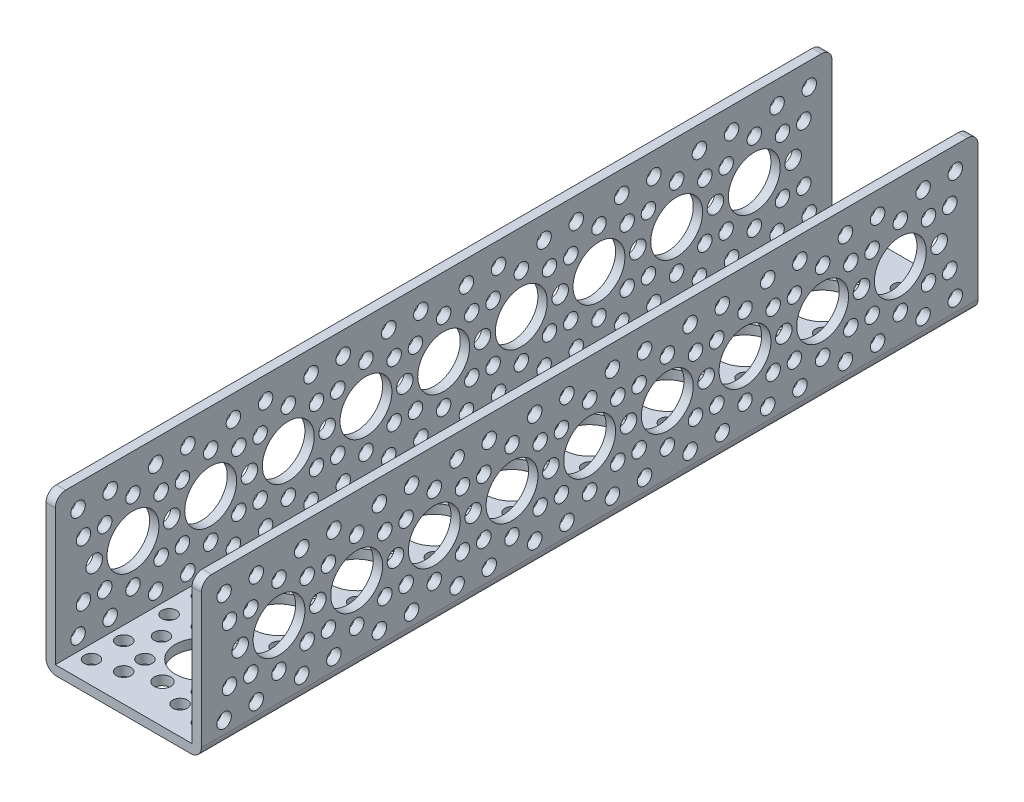
from build123d import *

# Parameters (mm, degrees)
SKETCH1_W                 = 38.1
SKETCH1_H                 = 190.5
BOSS_EXTRUDE1_DEPTH       = 38.1
SKETCH2_W                 = 33.528
SKETCH2_H                 = 35.814
CUT_EXTRUDE1_DEPTH        = 198.973407305
HOLE1_D                   = 12.7254
HOLE1_DEPTH               = 2.286
F_5_CLEARANCE_HOLE1_D     = 3.556
F_5_CLEARANCE_HOLE1_DEPTH = 2.286
F_6_CLEARANCE_HOLE1_D     = 4.064
F_6_CLEARANCE_HOLE1_DEPTH = 2.286
HOLE2_D                   = 12.7254
HOLE2_DEPTH               = 38.1
F_6_CLEARANCE_HOLE2_D     = 4.064
F_6_CLEARANCE_HOLE2_DEPTH = 38.1
F_5_CLEARANCE_HOLE2_D     = 3.556
F_5_CLEARANCE_HOLE2_DEPTH = 38.1
HOLE3_D                   = 12.7254
HOLE3_DEPTH               = 38.1
F_5_CLEARANCE_HOLE3_D     = 3.556
F_5_CLEARANCE_HOLE3_DEPTH = 38.1
F_6_CLEARANCE_HOLE3_D     = 4.064
F_6_CLEARANCE_HOLE3_DEPTH = 38.1
FILLET1_R                 = 2.54


with BuildPart() as part:
    # Sketch1 → Boss-Extrude1 (new body)
    with BuildSketch(Plane.XZ):
        with Locations((19.05, 95.25)):
            Rectangle(SKETCH1_W, SKETCH1_H)
    extrude(amount=-BOSS_EXTRUDE1_DEPTH)

    # Sketch2 → Cut-Extrude1 (cut, through all)
    with BuildSketch(Plane.XY.offset(190.5)):
        with Locations((19.05, 20.193)):
            Rectangle(SKETCH2_W, SKETCH2_H)
    extrude(amount=-CUT_EXTRUDE1_DEPTH, mode=Mode.SUBTRACT)

    # Hole1
    with Locations(Plane(origin=(38.1, 0, 0), x_dir=(0, 0, -1), z_dir=(1, 0, 0))):
        with Locations((-38.1, 19.05), (-19.05, 19.05), (-57.15, 19.05), (-76.2, 19.05), (-95.25, 19.05), (-114.3, 19.05), (-133.35, 19.05), (-152.4, 19.05), (-171.45, 19.05)):
            Hole(HOLE1_D / 2, depth=HOLE1_DEPTH)

    # #5 Clearance Hole1
    with Locations(Plane(origin=(38.1, 0, 0), x_dir=(0, 0, -1), z_dir=(1, 0, 0))):
        with Locations((-177.029615818, 5.579615818), (-183.585202787, 12.135202787), (-177.029615818, 32.520384182), (-183.585202787, 25.964797213), (-13.470384182, 5.579615818), (-6.914797213, 12.135202787), (-13.470384182, 32.520384182), (-6.914797213, 25.964797213), (-157.979615818, 5.579615818), (-138.929615818, 5.579615818), (-119.879615818, 5.579615818), (-100.829615818, 5.579615818), (-81.779615818, 5.579615818), (-62.729615818, 5.579615818), (-43.679615818, 5.579615818), (-24.629615818, 5.579615818), (-157.979615818, 32.520384182), (-138.929615818, 32.520384182), (-119.879615818, 32.520384182), (-100.829615818, 32.520384182), (-81.779615818, 32.520384182), (-62.729615818, 32.520384182), (-43.679615818, 32.520384182), (-24.629615818, 32.520384182), (-184.920384182, 5.579615818), (-184.920384182, 32.520384182), (-165.870384182, 5.579615818), (-165.870384182, 32.520384182), (-146.820384182, 5.579615818), (-146.820384182, 32.520384182), (-127.770384182, 5.579615818), (-127.770384182, 32.520384182), (-108.720384182, 5.579615818), (-108.720384182, 32.520384182), (-89.670384182, 5.579615818), (-89.670384182, 32.520384182), (-70.620384182, 5.579615818), (-70.620384182, 32.520384182), (-51.570384182, 5.579615818), (-51.570384182, 32.520384182), (-38.1, 9.271), (-45.014797213, 12.135202787), (-45.014797213, 25.964797213), (-38.1, 28.829), (-31.185202787, 25.964797213), (-31.185202787, 12.135202787), (-32.520384182, 5.579615818), (-32.520384182, 32.520384182), (-5.579615818, 5.579615818), (-5.579615818, 32.520384182), (-12.135202787, 12.135202787), (-19.05, 9.271), (-25.964797213, 12.135202787), (-25.964797213, 25.964797213), (-19.05, 28.829), (-12.135202787, 25.964797213), (-50.235202787, 12.135202787), (-69.285202787, 12.135202787), (-88.335202787, 12.135202787), (-107.385202787, 12.135202787), (-126.435202787, 12.135202787), (-145.485202787, 12.135202787), (-164.535202787, 12.135202787), (-50.235202787, 25.964797213), (-69.285202787, 25.964797213), (-88.335202787, 25.964797213), (-107.385202787, 25.964797213), (-126.435202787, 25.964797213), (-145.485202787, 25.964797213), (-164.535202787, 25.964797213), (-57.15, 28.829), (-76.2, 28.829), (-95.25, 28.829), (-114.3, 28.829), (-133.35, 28.829), (-152.4, 28.829), (-171.45, 28.829), (-64.064797213, 25.964797213), (-83.114797213, 25.964797213), (-102.164797213, 25.964797213), (-121.214797213, 25.964797213), (-140.264797213, 25.964797213), (-159.314797213, 25.964797213), (-178.364797213, 25.964797213), (-64.064797213, 12.135202787), (-83.114797213, 12.135202787), (-102.164797213, 12.135202787), (-121.214797213, 12.135202787), (-140.264797213, 12.135202787), (-159.314797213, 12.135202787), (-178.364797213, 12.135202787), (-57.15, 9.271), (-76.2, 9.271), (-95.25, 9.271), (-114.3, 9.271), (-133.35, 9.271), (-152.4, 9.271), (-171.45, 9.271)):
            Hole(F_5_CLEARANCE_HOLE1_D / 2, depth=F_5_CLEARANCE_HOLE1_DEPTH)

    # #6 Clearance Hole1
    with Locations(Plane(origin=(38.1, 0, 0), x_dir=(0, 0, -1), z_dir=(1, 0, 0))):
        with Locations((-180.975, 19.05), (-161.925, 19.05), (-142.875, 19.05), (-123.825, 19.05), (-104.775, 19.05), (-85.725, 19.05), (-66.675, 19.05), (-47.625, 19.05), (-28.575, 19.05), (-9.525, 19.05)):
            Hole(F_6_CLEARANCE_HOLE1_D / 2, depth=F_6_CLEARANCE_HOLE1_DEPTH)

    # Hole2
    with Locations(Plane(origin=(0, 0, 0), x_dir=(-1, 0, 0), z_dir=(0, -1, 0))):
        with Locations((-19.05, -171.45), (-19.05, -152.4), (-19.05, -133.35), (-19.05, -114.3), (-19.05, -95.25), (-19.05, -76.2), (-19.05, -57.15), (-19.05, -38.1), (-19.05, -19.05)):
            Hole(HOLE2_D / 2, depth=HOLE2_DEPTH)

    # #6 Clearance Hole2
    with Locations(Plane(origin=(0, 0, 0), x_dir=(-1, 0, 0), z_dir=(0, -1, 0))):
        with Locations((-19.05, -180.975), (-19.05, -161.925), (-19.05, -142.875), (-19.05, -123.825), (-19.05, -104.775), (-19.05, -85.725), (-19.05, -66.675), (-19.05, -47.625), (-19.05, -28.575), (-19.05, -9.525)):
            Hole(F_6_CLEARANCE_HOLE2_D / 2, depth=F_6_CLEARANCE_HOLE2_DEPTH)

    # #5 Clearance Hole2
    with Locations(Plane(origin=(0, 0, 0), x_dir=(-1, 0, 0), z_dir=(0, -1, 0))):
        with Locations((-5.579615818, -184.920384182), (-5.579615818, -177.029615818), (-12.135202787, -183.585202787), (-32.520384182, -184.920384182), (-32.520384182, -177.029615818), (-25.964797213, -183.585202787), (-5.579615818, -165.870384182), (-5.579615818, -157.979615818), (-32.520384182, -165.870384182), (-32.520384182, -157.979615818), (-5.579615818, -146.820384182), (-5.579615818, -138.929615818), (-32.520384182, -146.820384182), (-32.520384182, -138.929615818), (-5.579615818, -127.770384182), (-5.579615818, -119.879615818), (-32.520384182, -127.770384182), (-32.520384182, -119.879615818), (-5.579615818, -108.720384182), (-5.579615818, -100.829615818), (-32.520384182, -108.720384182), (-32.520384182, -100.829615818), (-5.579615818, -89.670384182), (-5.579615818, -81.779615818), (-32.520384182, -89.670384182), (-32.520384182, -81.779615818), (-5.579615818, -70.620384182), (-5.579615818, -62.729615818), (-32.520384182, -70.620384182), (-32.520384182, -62.729615818), (-5.579615818, -51.570384182), (-5.579615818, -43.679615818), (-32.520384182, -51.570384182), (-32.520384182, -43.679615818), (-12.135202787, -164.535202787), (-9.271, -171.45), (-12.135202787, -178.364797213), (-25.964797213, -178.364797213), (-28.829, -171.45), (-25.964797213, -164.535202787), (-12.135202787, -145.485202787), (-9.271, -152.4), (-12.135202787, -159.314797213), (-25.964797213, -159.314797213), (-28.829, -152.4), (-25.964797213, -145.485202787), (-12.135202787, -126.435202787), (-9.271, -133.35), (-12.135202787, -140.264797213), (-25.964797213, -140.264797213), (-28.829, -133.35), (-25.964797213, -126.435202787), (-12.135202787, -107.385202787), (-9.271, -114.3), (-12.135202787, -121.214797213), (-25.964797213, -121.214797213), (-28.829, -114.3), (-25.964797213, -107.385202787), (-12.135202787, -88.335202787), (-9.271, -95.25), (-12.135202787, -102.164797213), (-25.964797213, -102.164797213), (-28.829, -95.25), (-25.964797213, -88.335202787), (-12.135202787, -69.285202787), (-9.271, -76.2), (-12.135202787, -83.114797213), (-25.964797213, -83.114797213), (-28.829, -76.2), (-25.964797213, -69.285202787), (-12.135202787, -50.235202787), (-9.271, -57.15), (-12.135202787, -64.064797213), (-25.964797213, -64.064797213), (-28.829, -57.15), (-25.964797213, -50.235202787), (-9.271, -38.1), (-12.135202787, -45.014797213), (-25.964797213, -45.014797213), (-28.829, -38.1), (-5.579615818, -32.520384182), (-5.579615818, -24.629615818), (-12.135202787, -31.185202787), (-32.520384182, -32.520384182), (-32.520384182, -24.629615818), (-25.964797213, -31.185202787), (-5.579615818, -5.579615818), (-5.579615818, -13.470384182), (-12.135202787, -6.914797213), (-32.520384182, -5.579615818), (-32.520384182, -13.470384182), (-25.964797213, -6.914797213), (-12.135202787, -12.135202787), (-9.271, -19.05), (-12.135202787, -25.964797213), (-25.964797213, -25.964797213), (-28.829, -19.05), (-25.964797213, -12.135202787)):
            Hole(F_5_CLEARANCE_HOLE2_D / 2, depth=F_5_CLEARANCE_HOLE2_DEPTH)

    # Hole3
    with Locations(Plane.ZY):
        with Locations((38.1, 19.05), (19.05, 19.05), (57.15, 19.05), (76.2, 19.05), (95.25, 19.05), (114.3, 19.05), (133.35, 19.05), (152.4, 19.05), (171.45, 19.05)):
            Hole(HOLE3_D / 2, depth=HOLE3_DEPTH)

    # #5 Clearance Hole3
    with Locations(Plane.ZY):
        with Locations((177.029615818, 5.579615818), (183.585202787, 12.135202787), (177.029615818, 32.520384182), (183.585202787, 25.964797213), (13.470384182, 5.579615818), (6.914797213, 12.135202787), (13.470384182, 32.520384182), (6.914797213, 25.964797213), (157.979615818, 5.579615818), (138.929615818, 5.579615818), (119.879615818, 5.579615818), (100.829615818, 5.579615818), (81.779615818, 5.579615818), (62.729615818, 5.579615818), (43.679615818, 5.579615818), (24.629615818, 5.579615818), (157.979615818, 32.520384182), (138.929615818, 32.520384182), (119.879615818, 32.520384182), (100.829615818, 32.520384182), (81.779615818, 32.520384182), (62.729615818, 32.520384182), (43.679615818, 32.520384182), (24.629615818, 32.520384182), (184.920384182, 5.579615818), (184.920384182, 32.520384182), (165.870384182, 5.579615818), (165.870384182, 32.520384182), (146.820384182, 5.579615818), (146.820384182, 32.520384182), (127.770384182, 5.579615818), (127.770384182, 32.520384182), (108.720384182, 5.579615818), (108.720384182, 32.520384182), (89.670384182, 5.579615818), (89.670384182, 32.520384182), (70.620384182, 5.579615818), (70.620384182, 32.520384182), (51.570384182, 5.579615818), (51.570384182, 32.520384182), (31.185202787, 12.135202787), (38.1, 9.271), (45.014797213, 12.135202787), (45.014797213, 25.964797213), (38.1, 28.829), (31.185202787, 25.964797213), (32.520384182, 5.579615818), (32.520384182, 32.520384182), (5.579615818, 5.579615818), (5.579615818, 32.520384182), (12.135202787, 12.135202787), (19.05, 9.271), (25.964797213, 12.135202787), (25.964797213, 25.964797213), (19.05, 28.829), (12.135202787, 25.964797213), (50.235202787, 25.964797213), (69.285202787, 25.964797213), (88.335202787, 25.964797213), (107.385202787, 25.964797213), (126.435202787, 25.964797213), (145.485202787, 25.964797213), (164.535202787, 25.964797213), (57.15, 28.829), (76.2, 28.829), (95.25, 28.829), (114.3, 28.829), (133.35, 28.829), (152.4, 28.829), (171.45, 28.829), (64.064797213, 25.964797213), (83.114797213, 25.964797213), (102.164797213, 25.964797213), (121.214797213, 25.964797213), (140.264797213, 25.964797213), (159.314797213, 25.964797213), (178.364797213, 25.964797213), (64.064797213, 12.135202787), (83.114797213, 12.135202787), (102.164797213, 12.135202787), (121.214797213, 12.135202787), (140.264797213, 12.135202787), (159.314797213, 12.135202787), (178.364797213, 12.135202787), (57.15, 9.271), (76.2, 9.271), (95.25, 9.271), (114.3, 9.271), (133.35, 9.271), (152.4, 9.271), (171.45, 9.271), (50.235202787, 12.135202787), (69.285202787, 12.135202787), (88.335202787, 12.135202787), (107.385202787, 12.135202787), (126.435202787, 12.135202787), (145.485202787, 12.135202787), (164.535202787, 12.135202787)):
            Hole(F_5_CLEARANCE_HOLE3_D / 2, depth=F_5_CLEARANCE_HOLE3_DEPTH)

    # #6 Clearance Hole3
    with Locations(Plane.ZY):
        with Locations((180.975, 19.05), (161.925, 19.05), (142.875, 19.05), (123.825, 19.05), (104.775, 19.05), (85.725, 19.05), (66.675, 19.05), (47.625, 19.05), (28.575, 19.05), (9.525, 19.05)):
            Hole(F_6_CLEARANCE_HOLE3_D / 2, depth=F_6_CLEARANCE_HOLE3_DEPTH)

    # Fillet1
    fillet1_edges = [part.edges().sort_by_distance(p)[0] for p in [
        (1.143, 38.1, 190.5),
        (36.957, 38.1, 190.5),
        (36.957, 38.1, 0),
        (38.1, 0, 95.25),
        (1.143, 38.1, 0),
        (0, 0, 95.25),
    ]]
    fillet(fillet1_edges, radius=FILLET1_R)


solid = part.part
